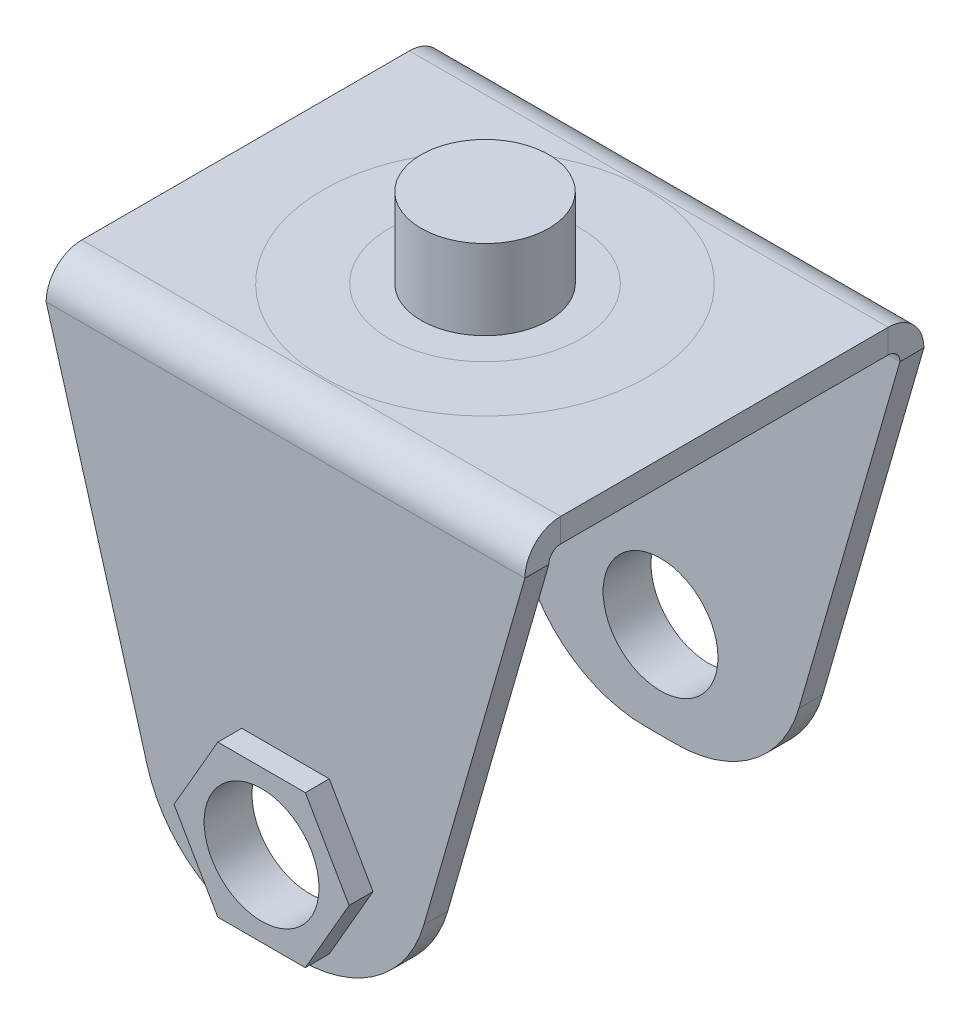
from build123d import *

# Parameters (mm, degrees)
SKETCH1_W                      = 30
SKETCH1_H                      = 22
BASE_FLANGE1_DEPTH             = 1.5
EDGE_FLANGE1_STRIP_W           = 7.4732
EDGE_FLANGE1_STRIP_H           = 1.5
EDGE_FLANGE1_STRIP_CUT_DEPTH   = 30
EDGE_FLANGE1_STRIP_2_W         = 7.4732
EDGE_FLANGE1_STRIP_2_H         = 1.5
EDGE_FLANGE1_STRIP_CUT_2_DEPTH = 30
EDGE_FLANGE1_DEPTH             = 30
EDGE_FLANGE1_BEND_DEPTH        = 30
CUT_EXTRUDE1_DEPTH             = 42.833001327
FILLET1_R                      = 8
SKETCH12_R                     = 3.6
CUT_EXTRUDE2_DEPTH             = 42.833001327
BOSS_EXTRUDE1_START            = 1.5
SKETCH13_R                     = 3.6
BOSS_EXTRUDE1_DEPTH            = 1.5
SKETCH14_R                     = 6
BOSS_EXTRUDE2_DEPTH            = 1
SKETCH15_R                     = 10
BOSS_EXTRUDE3_DEPTH            = 4
FILLET2_R                      = 2
SKETCH16_R                     = 4
BOSS_EXTRUDE4_DEPTH            = 5
CUT_EXTRUDE4_START             = -10
SKETCH17_R                     = 10.163794577
SKETCH17_R_2                   = 4
CUT_EXTRUDE4_DEPTH             = 10
CUT_EXTRUDE5_START             = -5
SKETCH18_R                     = 4
CUT_EXTRUDE5_DEPTH             = 5


# Sheet-metal steps are written as plain solids
with BuildPart() as part:
    # Sketch1 → Base-Flange1 (new body)
    with BuildSketch(Plane(origin=(0, 0, 0), x_dir=(1, 0, 0), z_dir=(0, 1, 0))):
        Rectangle(SKETCH1_W, SKETCH1_H)
    extrude(amount=-BASE_FLANGE1_DEPTH)

    # Edge-Flange1 strip (across the edge) → Edge-Flange1 strip cut (cut)
    with BuildSketch(Plane(origin=(15, -1.5, 11), x_dir=(0, 0, -1), z_dir=(-1, 0, 0))):
        with Locations((-3, -0.75)):
            Rectangle(EDGE_FLANGE1_STRIP_W, EDGE_FLANGE1_STRIP_H)
    extrude(amount=EDGE_FLANGE1_STRIP_CUT_DEPTH, mode=Mode.SUBTRACT)

    # Edge-Flange1 strip 2 (across the edge) → Edge-Flange1 strip cut 2 (cut)
    with BuildSketch(Plane(origin=(-15, -1.5, -11), x_dir=(0, 0, 1), z_dir=(1, 0, 0))):
        with Locations((-3, -0.75)):
            Rectangle(EDGE_FLANGE1_STRIP_2_W, EDGE_FLANGE1_STRIP_2_H)
    extrude(amount=EDGE_FLANGE1_STRIP_CUT_2_DEPTH, mode=Mode.SUBTRACT)

    # Edge-Flange1 section (across the edge) → Edge-Flange1 (add)
    with BuildSketch(Plane(origin=(15, -1.5, 11), x_dir=(0, 0, -1), z_dir=(-1, 0, 0))):
        with BuildLine():
            Line((-1.5, 0.7366), (-1.5, 28.5))
            Line((-1.5, 28.5), (0, 28.5))
            Line((0, 28.5), (0, 0.7366))
            ThreePointArc((0, 0.7366), (0.215745145, 0.215745145), (0.7366, 0))
            Line((0.7366, 0), (0.7366, -1.5))
            ThreePointArc((0.7366, -1.5), (-0.844915027, -0.844915027), (-1.5, 0.7366))
        make_face()
    extrude(amount=EDGE_FLANGE1_DEPTH)

    # Edge-Flange1 section 2 (across the edge) → Edge-Flange1 bend (add)
    with BuildSketch(Plane(origin=(-15, -1.5, -11), x_dir=(0, 0, 1), z_dir=(1, 0, 0))):
        with BuildLine():
            Line((-1.5, 0.7366), (-1.5, 28.5))
            Line((-1.5, 28.5), (0, 28.5))
            Line((0, 28.5), (0, 0.7366))
            ThreePointArc((0, 0.7366), (0.215745145, 0.215745145), (0.7366, 0))
            Line((0.7366, 0), (0.7366, -1.5))
            ThreePointArc((0.7366, -1.5), (-0.844915027, -0.844915027), (-1.5, 0.7366))
        make_face()
    extrude(amount=EDGE_FLANGE1_BEND_DEPTH)

    # Sketch11 → Cut-Extrude1 (cut, through all)
    with BuildSketch(Plane.XY.offset(12.5)):
        Polygon((-15, -2.2366), (-7, -30), (-15, -30), align=None)
        Polygon((15, -2.2366), (7, -30), (15, -30), align=None)
    extrude(amount=-CUT_EXTRUDE1_DEPTH, mode=Mode.SUBTRACT)

    # Fillet1
    fillet1_edges = [part.edges().sort_by_distance(p)[0] for p in [
        (7, -30, 11.75),
        (7, -30, -11.75),
        (-7, -30, 11.75),
        (-7, -30, -11.75),
    ]]
    fillet(fillet1_edges, radius=FILLET1_R)

    # Sketch12 → Cut-Extrude2 (cut, through all)
    with BuildSketch(Plane.XY.offset(12.5)):
        with Locations((0, -24)):
            Circle(SKETCH12_R)
    extrude(amount=-CUT_EXTRUDE2_DEPTH, mode=Mode.SUBTRACT)

    # Sketch13 → Boss-Extrude1 (add)
    with BuildSketch(Plane.XY.offset(12.5).offset(BOSS_EXTRUDE1_START)):
        Polygon((5.484827557, -24), (2.742413779, -19.25), (-2.742413779, -19.25), (-5.484827557, -24), (-2.742413779, -28.75), (2.742413779, -28.75), align=None)
        with Locations((0, -24)):
            Circle(SKETCH13_R, mode=Mode.SUBTRACT)
    boss_extrude1 = extrude(amount=-BOSS_EXTRUDE1_DEPTH)

    # Mirror1: Boss-Extrude1 across plane
    add(boss_extrude1.mirror(Plane.XY))

    # Sketch14 → Boss-Extrude2 (add)
    with BuildSketch(Plane(origin=(0, 0, 0), x_dir=(1, 0, 0), z_dir=(0, 1, 0))):
        with Locations(Location((0, 0, 0), (0, 0, 90))):
            Circle(SKETCH14_R)
    extrude(amount=BOSS_EXTRUDE2_DEPTH)

    # Sketch15 → Boss-Extrude3 (add)
    with BuildSketch(Plane(origin=(0, 1, 0), x_dir=(1, 0, 0), z_dir=(0, 1, 0))):
        with Locations(Location((0, 0, 0), (0, 0, 270))):
            Circle(SKETCH15_R)
    extrude(amount=BOSS_EXTRUDE3_DEPTH)

    # Fillet2
    fillet2_edges = [part.edges().sort_by_distance(p)[0] for p in [
        (0, 1, -10),
    ]]
    fillet(fillet2_edges, radius=FILLET2_R)

    # Sketch16 → Boss-Extrude4 (add)
    with BuildSketch(Plane(origin=(0, 5, 0), x_dir=(1, 0, 0), z_dir=(0, 1, 0))):
        with Locations(Location((0, 0, 0), (0, 0, 270))):
            Circle(SKETCH16_R)
    extrude(amount=BOSS_EXTRUDE4_DEPTH)

    # Sketch17 → Cut-Extrude4 (cut)
    with BuildSketch(Plane(origin=(0, 10, 0), x_dir=(1, 0, 0), z_dir=(0, 1, 0)).offset(CUT_EXTRUDE4_START)):
        Circle(SKETCH17_R)
        with Locations(Location((0, 0, 0), (0, 0, 270))):
            Circle(SKETCH17_R_2, mode=Mode.SUBTRACT)
    extrude(amount=CUT_EXTRUDE4_DEPTH, mode=Mode.SUBTRACT)

    # Sketch18 → Cut-Extrude5 (cut)
    with BuildSketch(Plane(origin=(0, 10, 0), x_dir=(1, 0, 0), z_dir=(0, 1, 0)).offset(CUT_EXTRUDE5_START)):
        with Locations(Location((0, 0, 0), (0, 0, 270))):
            Circle(SKETCH18_R)
    extrude(amount=CUT_EXTRUDE5_DEPTH, mode=Mode.SUBTRACT)


solid = part.part
